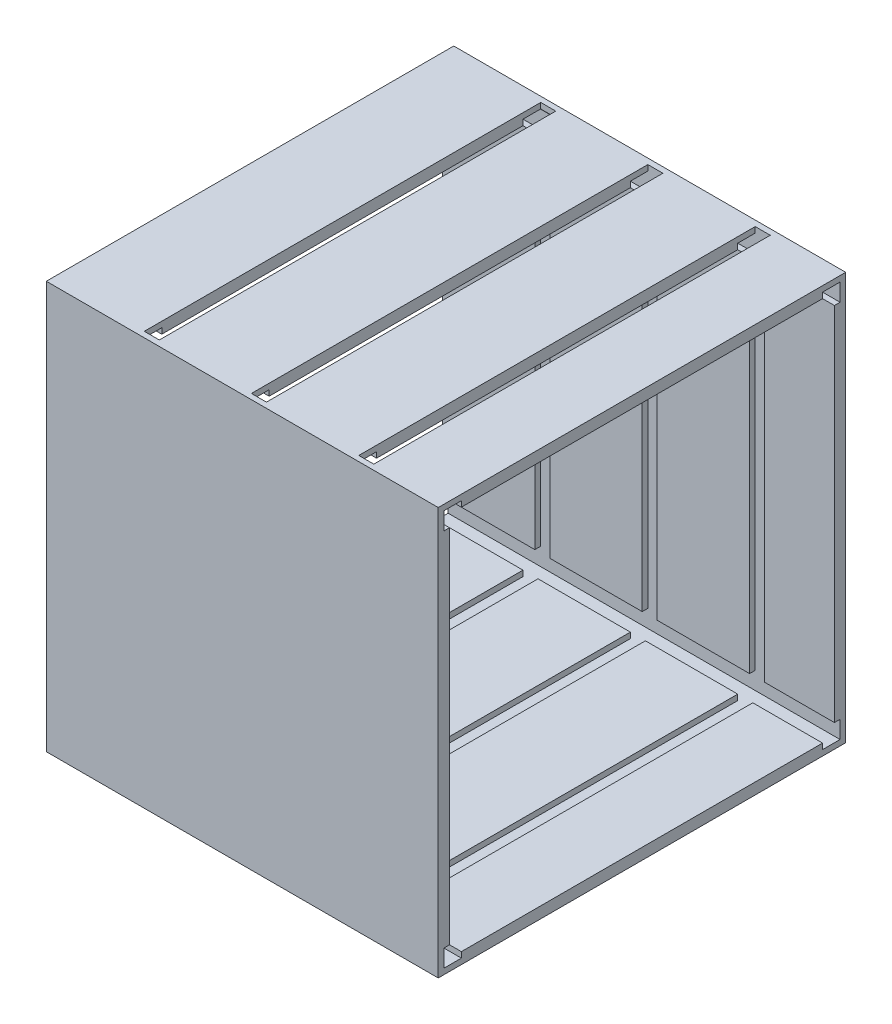
from build123d import *

# Parameters (mm, degrees)
SKETCH1_W            = 688.1
SKETCH1_H            = 688.1
SKETCH1_W_2          = 650
SKETCH1_H_2          = 650
BOSS_EXTRUDE1_DEPTH  = 661.9
SKETCH3_W            = 25.4
SKETCH3_H            = 650
CUT_EXTRUDE1_DEPTH   = 9.525
SKETCH4_W            = 25.4
SKETCH4_H            = 669.5
SKETCH4_H_2          = 669.05
CUT_EXTRUDE3_DEPTH   = 9.525
SKETCH6_W            = 25.4
SKETCH6_H            = 669.5
CUT_EXTRUDE4_DEPTH   = 9.525
CUT_EXTRUDE5_DEPTH   = 700
MIRROR6_COPY_1_DEPTH = 700
MIRROR6_COPY_2_DEPTH = 700


with BuildPart() as part:
    # Sketch1 → Boss-Extrude1 (new body)
    with BuildSketch(Plane(origin=(0, 0, 0), x_dir=(0, 0, -1), z_dir=(1, 0, 0))):
        with Locations((344.05, 344.05)):
            Rectangle(SKETCH1_W, SKETCH1_H)
        with Locations((344.05, 344.05)):
            Rectangle(SKETCH1_W_2, SKETCH1_H_2, mode=Mode.SUBTRACT)
    extrude(amount=BOSS_EXTRUDE1_DEPTH)

    # Sketch3 → Cut-Extrude1 (cut)
    with BuildSketch(Plane.XY.offset(-669.05)):
        with Locations((168.65, 344.05)):
            Rectangle(SKETCH3_W, SKETCH3_H)
        with Locations((350, 344.05)):
            Rectangle(SKETCH3_W, SKETCH3_H)
        with Locations((531.35, 344.05)):
            Rectangle(SKETCH3_W, SKETCH3_H)
    cut_extrude1 = extrude(amount=-CUT_EXTRUDE1_DEPTH, mode=Mode.SUBTRACT)

    # Mirror2: Cut-Extrude1 across plane
    add(cut_extrude1.mirror(Plane(origin=(0, 0, -344.05), x_dir=(1, 0, 0), z_dir=(0, 0, -1))), mode=Mode.SUBTRACT)

    # Sketch4 → Cut-Extrude3 (cut)
    with BuildSketch(Plane(origin=(0, 19.05, 0), x_dir=(1, 0, 0), z_dir=(0, 1, 0))):
        with Locations((168.65, 343.825)):
            Rectangle(SKETCH4_W, SKETCH4_H)
        with Locations((350, 343.825)):
            Rectangle(SKETCH4_W, SKETCH4_H)
        with Locations((531.35, 344.05)):
            Rectangle(SKETCH4_W, SKETCH4_H_2)
    cut_extrude3 = extrude(amount=-CUT_EXTRUDE3_DEPTH, mode=Mode.SUBTRACT)

    # Mirror4: Cut-Extrude3 across plane
    add(cut_extrude3.mirror(Plane.ZX.offset(344.05)), mode=Mode.SUBTRACT)

    # Sketch6 → Cut-Extrude4 (cut)
    with BuildSketch(Plane(origin=(0, 688.1, 0), x_dir=(1, 0, 0), z_dir=(0, 1, 0))):
        with Locations((168.65, 344.275)):
            Rectangle(SKETCH6_W, SKETCH6_H)
        with Locations((350, 343.825)):
            Rectangle(SKETCH6_W, SKETCH6_H)
        with Locations((531.35, 343.825)):
            Rectangle(SKETCH6_W, SKETCH6_H)
    extrude(amount=-CUT_EXTRUDE4_DEPTH, mode=Mode.SUBTRACT)

    # Sketch7 → Cut-Extrude5 (cut)
    with BuildSketch(Plane.ZY):
        Polygon((-19.05, 39.05), (-9.525, 39.05), (-9.525, 9.525), (-39.05, 9.525), (-39.05, 19.05), (-19.05, 19.05), align=None)
    cut_extrude5 = extrude(amount=-CUT_EXTRUDE5_DEPTH, mode=Mode.SUBTRACT)

    # Mirror5: Cut-Extrude5 across plane
    add(cut_extrude5.mirror(Plane(origin=(0, 0, -344.05), x_dir=(1, 0, 0), z_dir=(0, 0, -1))), mode=Mode.SUBTRACT)

    # Mirror6 copy 1 sketch → Mirror6 copy 1 (cut)
    with BuildSketch(Plane(origin=(0, 688.1, -688.1), x_dir=(0, 0, -1), z_dir=(-1, 0, 0))):
        Polygon((-19.05, 39.05), (-9.525, 39.05), (-9.525, 9.525), (-39.05, 9.525), (-39.05, 19.05), (-19.05, 19.05), align=None)
    extrude(amount=-MIRROR6_COPY_1_DEPTH, mode=Mode.SUBTRACT)

    # Mirror6 copy 2 sketch → Mirror6 copy 2 (cut)
    with BuildSketch(Plane(origin=(0, 688.1, 0), x_dir=(0, 0, 1), z_dir=(-1, 0, 0))):
        Polygon((-19.05, -39.05), (-9.525, -39.05), (-9.525, -9.525), (-39.05, -9.525), (-39.05, -19.05), (-19.05, -19.05), align=None)
    extrude(amount=-MIRROR6_COPY_2_DEPTH, mode=Mode.SUBTRACT)


solid = part.part
